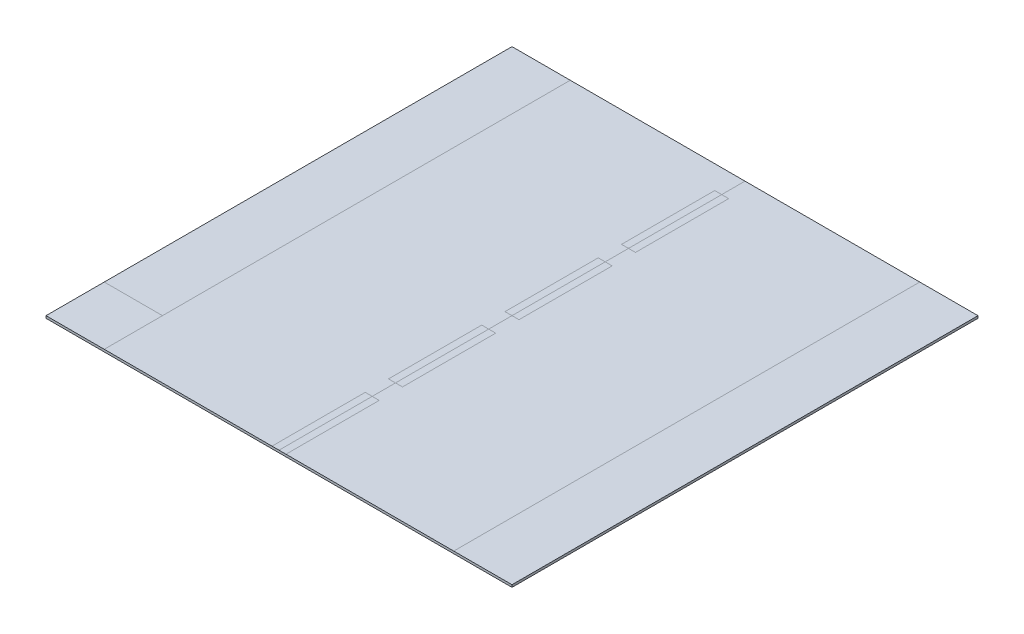
from build123d import *

# Parameters (mm, degrees)
SKETCH8_W            = 1000
SKETCH8_H            = 1000
BOSS_EXTRUDE18_DEPTH = 5


with BuildPart() as part:
    # Sketch8 → Boss-Extrude18 (new body)
    with BuildSketch(Plane(origin=(0, 0, 0), x_dir=(1, 0, 0), z_dir=(0, 1, 0))):
        with Locations((203.438395415, 59.455587393)):
            Rectangle(SKETCH8_W, SKETCH8_H)
    extrude(amount=BOSS_EXTRUDE18_DEPTH)


solid = part.part
